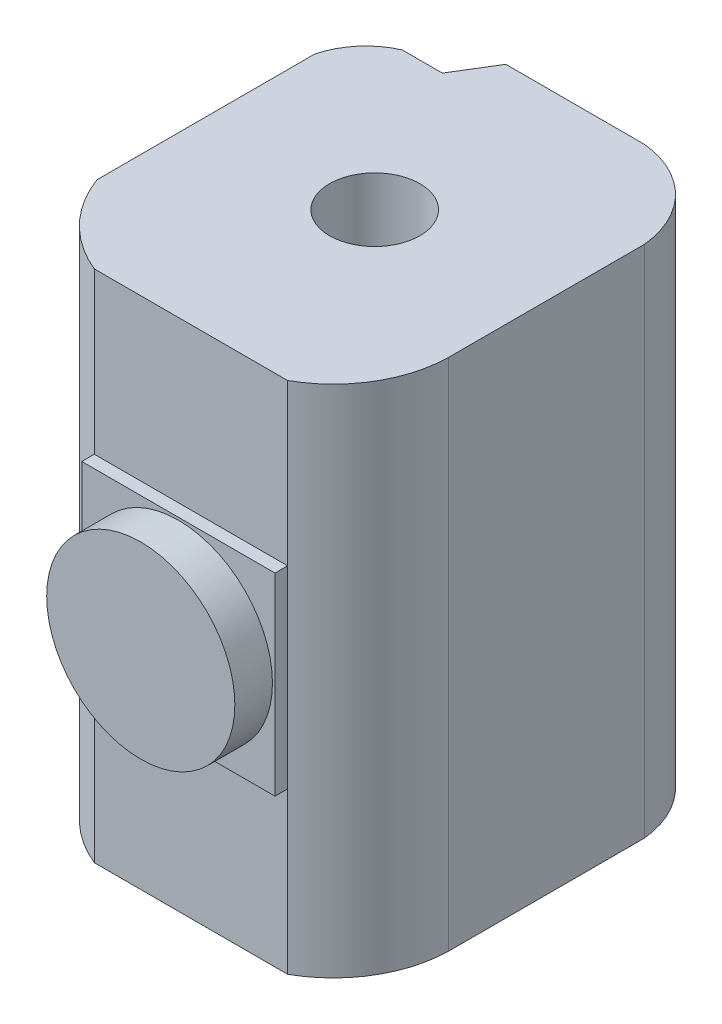
from build123d import *

# Parameters (mm, degrees)
SKETCH3_W               = 262.8
SKETCH3_H               = 305.28
BOSS_EXTRUDE3_DEPTH     = 410
CUT_EXTRUDE1_DEPTH      = 457.798565672
CUT_EXTRUDE1_DEPTH_BACK = 457.798565672
CUT_EXTRUDE2_DEPTH      = 457.798565672
CUT_EXTRUDE2_DEPTH_BACK = 457.798565672
SKETCH5_R               = 36
SKETCH6_W               = 154.08
SKETCH6_H               = 154.08
BOSS_EXTRUDE4_DEPTH     = 10
SKETCH7_R               = 75
BOSS_EXTRUDE5_DEPTH     = 30


with BuildPart() as part:
    # Sketch3 → Boss-Extrude3 (new body)
    with BuildSketch(Plane(origin=(0, 0, 0), x_dir=(1, 0, 0), z_dir=(0, 1, 0))):
        Rectangle(SKETCH3_W, SKETCH3_H)
    extrude(amount=BOSS_EXTRUDE3_DEPTH)

    # Sketch4 → Cut-Extrude1 (cut, two sides: drawn at the far end of the back side and taken through both)
    with BuildSketch(Plane(origin=(0, 410, 0), x_dir=(1, 0, 0), z_dir=(0, 1, 0)).offset(-CUT_EXTRUDE1_DEPTH_BACK)):
        with BuildLine():
            Line((-131.4, -90), (-131.4, -152.64))
            Line((-131.4, -152.64), (-70.92, -152.64))
            ThreePointArc((-70.92, -152.64), (-107.755247271, -127.687824951), (-131.4, -90))
        make_face()
        with BuildLine():
            Line((83.16, -152.64), (131.4, -152.64))
            Line((131.4, -152.64), (131.4, -72.72))
            ThreePointArc((131.4, -72.72), (117.938305095, -119.113391364), (83.16, -152.64))
        make_face()
        with BuildLine():
            Line((-99.372734155, 121.287125755), (-67.345468311, 121.287125755))
            Line((-67.345468311, 121.287125755), (-48.15934209, 152.64))
            Line((-48.15934209, 152.64), (-131.4, 152.64))
            Line((-131.4, 152.64), (-131.4, 83.52))
            ThreePointArc((-131.4, 83.52), (-119.737831056, 106.093689962), (-99.372734155, 121.287125755))
        make_face()
        with BuildLine():
            Line((131.4, 83.52), (131.4, 152.64))
            Line((131.4, 152.64), (62.28, 152.64))
            ThreePointArc((62.28, 152.64), (109.286007047, 130.526007047), (131.4, 83.52))
        make_face()
    extrude(amount=CUT_EXTRUDE1_DEPTH + CUT_EXTRUDE1_DEPTH_BACK, mode=Mode.SUBTRACT)

    # Sketch5 → Cut-Extrude2 (cut, two sides: drawn at the far end of the back side and taken through both)
    with BuildSketch(Plane(origin=(0, 410, 0), x_dir=(1, 0, 0), z_dir=(0, 1, 0)).offset(-CUT_EXTRUDE2_DEPTH_BACK)):
        Circle(SKETCH5_R)
    extrude(amount=CUT_EXTRUDE2_DEPTH + CUT_EXTRUDE2_DEPTH_BACK, mode=Mode.SUBTRACT)

    # Sketch6 → Boss-Extrude4 (add)
    with BuildSketch(Plane.XY.offset(152.64)):
        with Locations((6.12, 205)):
            Rectangle(SKETCH6_W, SKETCH6_H)
    extrude(amount=BOSS_EXTRUDE4_DEPTH)

    # Sketch7 → Boss-Extrude5 (add)
    with BuildSketch(Plane.XY.offset(162.64)):
        with Locations((6.12, 205)):
            Circle(SKETCH7_R)
    extrude(amount=BOSS_EXTRUDE5_DEPTH)


solid = part.part
